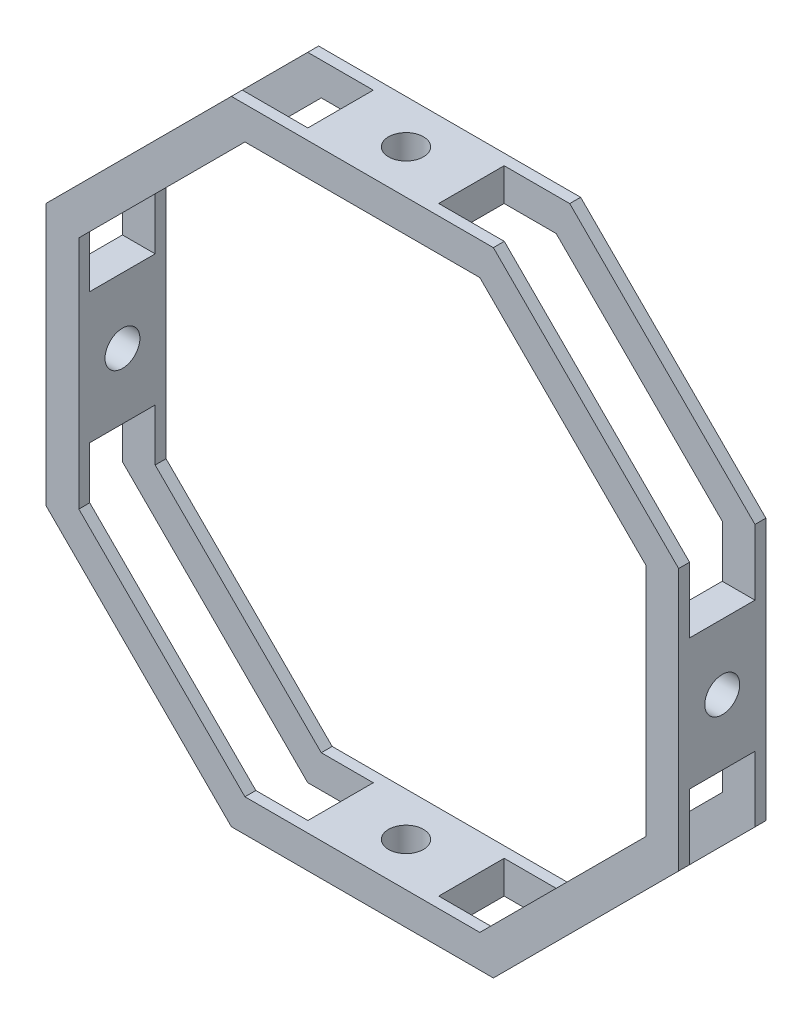
from build123d import *

# Parameters (mm, degrees)
RESSALTO_EXTRUS_O1_DEPTH   = 40
CORTE_EXTRUS_O1_DEPTH      = 327.687924478
CORTE_EXTRUS_O1_DEPTH_BACK = 327.687924478
ESBO_O2_R                  = 8
ESBO_O2_W                  = 30
ESBO_O2_H                  = 30.060966544
CORTE_EXTRUS_O2_DEPTH      = 353.338871398
CORTE_EXTRUS_O2_DEPTH_BACK = 353.338871398
ESBO_O3_W                  = 30
ESBO_O3_H                  = 120.121933088
CORTE_EXTRUS_O3_DEPTH      = 327.687924478
CORTE_EXTRUS_O3_DEPTH_BACK = 327.687924478
ESBO_O5_R                  = 8
CORTE_EXTRUS_O4_DEPTH      = 327.687924478
CORTE_EXTRUS_O4_DEPTH_BACK = 327.687924478
ESBO_O4_W                  = 30.060966544
ESBO_O4_H                  = 30
CORTE_EXTRUS_O5_DEPTH      = 353.338871398
CORTE_EXTRUS_O5_DEPTH_BACK = 353.338871398
ESBO_O7_W                  = 30
ESBO_O7_H                  = 120.121933088


with BuildPart() as part:
    # Esboço1 → Ressalto-extrusão1 (new body)
    with BuildSketch(Plane.XY):
        Polygon((145, 60.060966544), (60.060966544, 145), (-60.060966544, 145), (-145, 60.060966544), (-145, -60.060966544), (-60.060966544, -145), (60.060966544, -145), (145, -60.060966544), align=None)
        Polygon((130, 53.847763109), (53.847763109, 130), (-53.847763109, 130), (-130, 53.847763109), (-130, -53.847763109), (-53.847763109, -130), (53.847763109, -130), (130, -53.847763109), align=None, mode=Mode.SUBTRACT)
    extrude(amount=RESSALTO_EXTRUS_O1_DEPTH)

    # Esboço2 → Corte-extrusão1 (cut, two sides: drawn at the far end of the back side and taken through both)
    with BuildSketch(Plane(origin=(145, 0, 0), x_dir=(0, 0, -1), z_dir=(1, 0, 0)).offset(-CORTE_EXTRUS_O1_DEPTH_BACK)):
        with Locations((-20, 0)):
            Circle(ESBO_O2_R)
        with Locations((-20, 45.030483272)):
            Rectangle(ESBO_O2_W, ESBO_O2_H)
        with Locations((-20, -45.030483272)):
            Rectangle(ESBO_O2_W, ESBO_O2_H)
    extrude(amount=CORTE_EXTRUS_O1_DEPTH + CORTE_EXTRUS_O1_DEPTH_BACK, mode=Mode.SUBTRACT)

    # Esboço3 → Corte-extrusão2 (cut, two sides: drawn at the far end of the back side and taken through both)
    with BuildSketch(Plane(origin=(102.530483272, 102.530483272, 0), x_dir=(0, 0, -1), z_dir=(0.7071067811865469, 0.7071067811865481, 0)).offset(-CORTE_EXTRUS_O2_DEPTH_BACK)):
        with Locations((-20, 0)):
            Rectangle(ESBO_O3_W, ESBO_O3_H)
    extrude(amount=CORTE_EXTRUS_O2_DEPTH + CORTE_EXTRUS_O2_DEPTH_BACK, mode=Mode.SUBTRACT)

    # Esboço5 → Corte-extrusão3 (cut, two sides: drawn at the far end of the back side and taken through both)
    with BuildSketch(Plane(origin=(0, 145, 0), x_dir=(1, 0, 0), z_dir=(0, 1, 0)).offset(-CORTE_EXTRUS_O3_DEPTH_BACK)):
        with Locations((0, -20)):
            Circle(ESBO_O5_R)
    extrude(amount=CORTE_EXTRUS_O3_DEPTH + CORTE_EXTRUS_O3_DEPTH_BACK, mode=Mode.SUBTRACT)

    # Esboço4 → Corte-extrusão4 (cut, two sides: drawn at the far end of the back side and taken through both)
    with BuildSketch(Plane(origin=(0, 145, 0), x_dir=(1, 0, 0), z_dir=(0, 1, 0)).offset(-CORTE_EXTRUS_O4_DEPTH_BACK)):
        with Locations((45.030483272, -20)):
            Rectangle(ESBO_O4_W, ESBO_O4_H)
        with Locations((-45.030483272, -20)):
            Rectangle(ESBO_O4_W, ESBO_O4_H)
    extrude(amount=CORTE_EXTRUS_O4_DEPTH + CORTE_EXTRUS_O4_DEPTH_BACK, mode=Mode.SUBTRACT)

    # Esboço7 → Corte-extrusão5 (cut, two sides: drawn at the far end of the back side and taken through both)
    with BuildSketch(Plane(origin=(-102.530483272, 102.530483272, 0), x_dir=(0, 0, 1), z_dir=(-0.7071067811865479, 0.7071067811865472, 0)).offset(-CORTE_EXTRUS_O5_DEPTH_BACK)):
        with Locations((20, 0)):
            Rectangle(ESBO_O7_W, ESBO_O7_H)
    extrude(amount=CORTE_EXTRUS_O5_DEPTH + CORTE_EXTRUS_O5_DEPTH_BACK, mode=Mode.SUBTRACT)


solid = part.part
